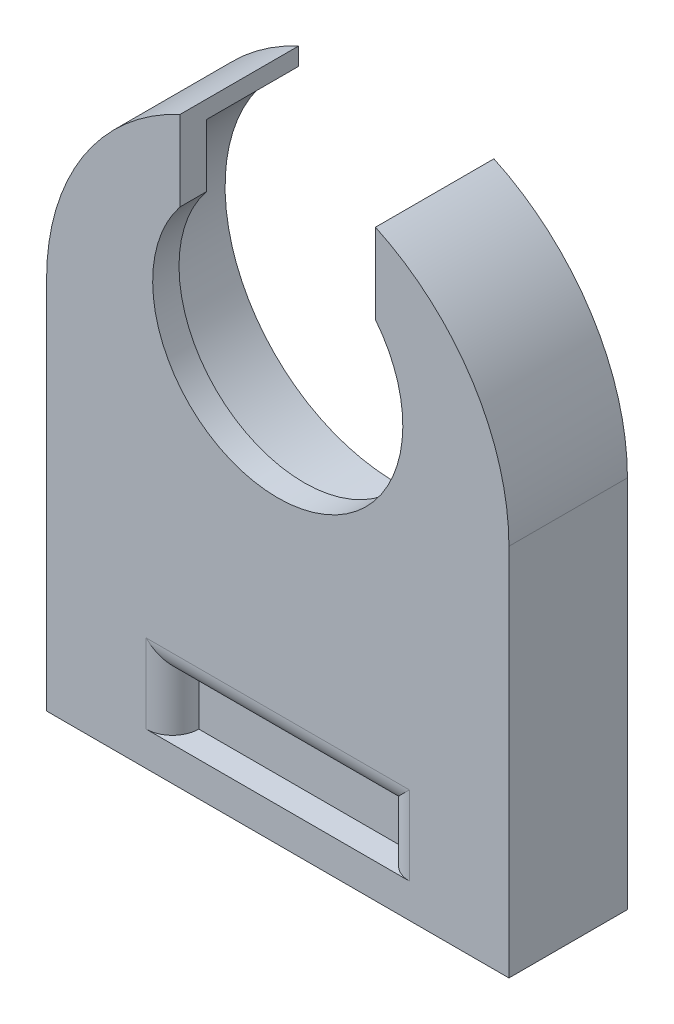
from build123d import *

# Parameters (mm, degrees)
BOSS_EXTRUDE1_DEPTH = 3.5
BOSS_EXTRUDE2_DEPTH = 1
SKETCH4_R           = 4.75
CUT_EXTRUDE1_DEPTH  = 24.115651093
SKETCH5_W           = 17.56
SKETCH5_H           = 4.5
BOSS_EXTRUDE3_DEPTH = 0.15
SKETCH6_W           = 17.56
SKETCH6_H           = 4.5
BOSS_EXTRUDE4_DEPTH = 7.5
SKETCH9_W           = 8
SKETCH9_H           = 2
CUT_EXTRUDE2_DEPTH  = 1
FILLET1_R           = 1
CUT_EXTRUDE3_REACH  = 30.715
SKETCH10_W          = 6.92
SKETCH10_H          = 1
SKETCH11_W          = 4.5
SKETCH11_H          = 3.588872583
CUT_EXTRUDE4_DEPTH  = 0.25


with BuildPart() as part:
    # Sketch1 → Boss-Extrude1 (new body)
    with BuildSketch(Plane.XY):
        with BuildLine():
            ThreePointArc((14.980604809, 6.55), (8.78, 2), (2.579395191, 6.55))
            Line((2.579395191, 6.55), (0, 6.55))
            Line((0, 6.55), (0, 0))
            Line((0, 0), (17.56, 0))
            Line((17.56, 0), (17.56, 6.55))
            Line((17.56, 6.55), (14.980604809, 6.55))
        make_face()
        with BuildLine():
            ThreePointArc((2.579395191, 6.55), (2.679421093, 10.743420825), (5.32, 14.002581212))
            Line((5.32, 14.002581212), (5.32, 14.619498126))
            ThreePointArc((5.32, 14.619498126), (1.449679407, 11.382680416), (0, 6.55))
            Line((0, 6.55), (2.579395191, 6.55))
        make_face()
        with BuildLine():
            ThreePointArc((12.24, 14.002581212), (14.880578907, 10.743420825), (14.980604809, 6.55))
            Line((14.980604809, 6.55), (17.56, 6.55))
            ThreePointArc((17.56, 6.55), (16.110320593, 11.382680416), (12.24, 14.619498126))
            Line((12.24, 14.619498126), (12.24, 14.002581212))
        make_face()
    extrude(amount=BOSS_EXTRUDE1_DEPTH)

    # Sketch3 → Boss-Extrude2 (add)
    with BuildSketch(Plane.XY.offset(3.5)):
        with BuildLine():
            Line((12.24, 14.619498126), (12.24, 14.002581212))
            ThreePointArc((12.24, 14.002581212), (8.78, 2), (5.32, 14.002581212))
            Line((5.32, 14.002581212), (5.32, 14.619498126))
            ThreePointArc((5.32, 14.619498126), (1.449679407, 11.382680416), (0, 6.55))
            Line((0, 6.55), (0, 0))
            Line((0, 0), (17.56, 0))
            Line((17.56, 0), (17.56, 6.55))
            ThreePointArc((17.56, 6.55), (16.110320593, 11.382680416), (12.24, 14.619498126))
        make_face()
        with BuildLine():
            Line((5.32, 14.619498126), (12.24, 14.619498126))
            Line((12.24, 14.619498126), (12.24, 14.002581212))
            ThreePointArc((12.24, 14.002581212), (8.78, 2), (5.32, 14.002581212))
            Line((5.32, 14.002581212), (5.32, 14.619498126))
        make_face()
    extrude(amount=BOSS_EXTRUDE2_DEPTH)

    # Sketch4 → Cut-Extrude1 (cut, through all)
    with BuildSketch(Plane(origin=(0, 0, 3.5), x_dir=(-1, 0, 0), z_dir=(0, 0, -1))):
        with Locations((-8.78, 8.5)):
            Circle(SKETCH4_R)
    extrude(amount=-CUT_EXTRUDE1_DEPTH, mode=Mode.SUBTRACT)

    # Sketch5 → Boss-Extrude3 (add)
    with BuildSketch(Plane.XZ):
        with Locations((8.78, 2.25)):
            Rectangle(SKETCH5_W, SKETCH5_H)
    extrude(amount=BOSS_EXTRUDE3_DEPTH)

    # Sketch6 → Boss-Extrude4 (add)
    with BuildSketch(Plane.XZ.offset(0.15)):
        with Locations((8.78, 2.25)):
            Rectangle(SKETCH6_W, SKETCH6_H)
    extrude(amount=BOSS_EXTRUDE4_DEPTH)

    # Sketch9 → Cut-Extrude2 (cut)
    with BuildSketch(Plane.XY.offset(4.5)):
        with Locations((8.78, -5.353166831)):
            Rectangle(SKETCH9_W, SKETCH9_H)
    extrude(amount=-CUT_EXTRUDE2_DEPTH, mode=Mode.SUBTRACT)

    # Fillet1
    fillet1_edges = [part.edges().sort_by_distance(p)[0] for p in [
        (4.78, -5.353166831, 4.5),
        (12.78, -5.353166831, 4.5),
        (8.78, -4.353166831, 4.5),
    ]]
    fillet(fillet1_edges, radius=FILLET1_R - 0.0001)  # a hair under: the kernel refuses the full size

    # Sketch10 → Cut-Extrude3 (cut, up to next)
    with BuildSketch(Plane(origin=(0, 14.619498126, 0), x_dir=(1, 0, 0), z_dir=(0, 1, 0)), mode=Mode.PRIVATE) as cut_extrude3_sk1:
        with Locations((8.78, -4)):
            Rectangle(SKETCH10_W, SKETCH10_H)
    cut_extrude3_tool1 = extrude(cut_extrude3_sk1.sketch, amount=-CUT_EXTRUDE3_REACH, mode=Mode.PRIVATE) & part.part
    add(cut_extrude3_tool1.solids().sort_by_distance((8.78, 14.619498, 4))[0], mode=Mode.SUBTRACT)

    # Sketch11 → Cut-Extrude4 (cut)
    with BuildSketch(Plane(origin=(5.32, 0, 0), x_dir=(0, 0, -1), z_dir=(1, 0, 0))):
        with Locations((-2.25, 12.825061835)):
            Rectangle(SKETCH11_W, SKETCH11_H)
    cut_extrude4 = extrude(amount=-CUT_EXTRUDE4_DEPTH, mode=Mode.SUBTRACT)

    # Mirror1: Cut-Extrude4 across plane
    add(cut_extrude4.mirror(Plane.ZY.offset(-8.78)), mode=Mode.SUBTRACT)


solid = part.part
